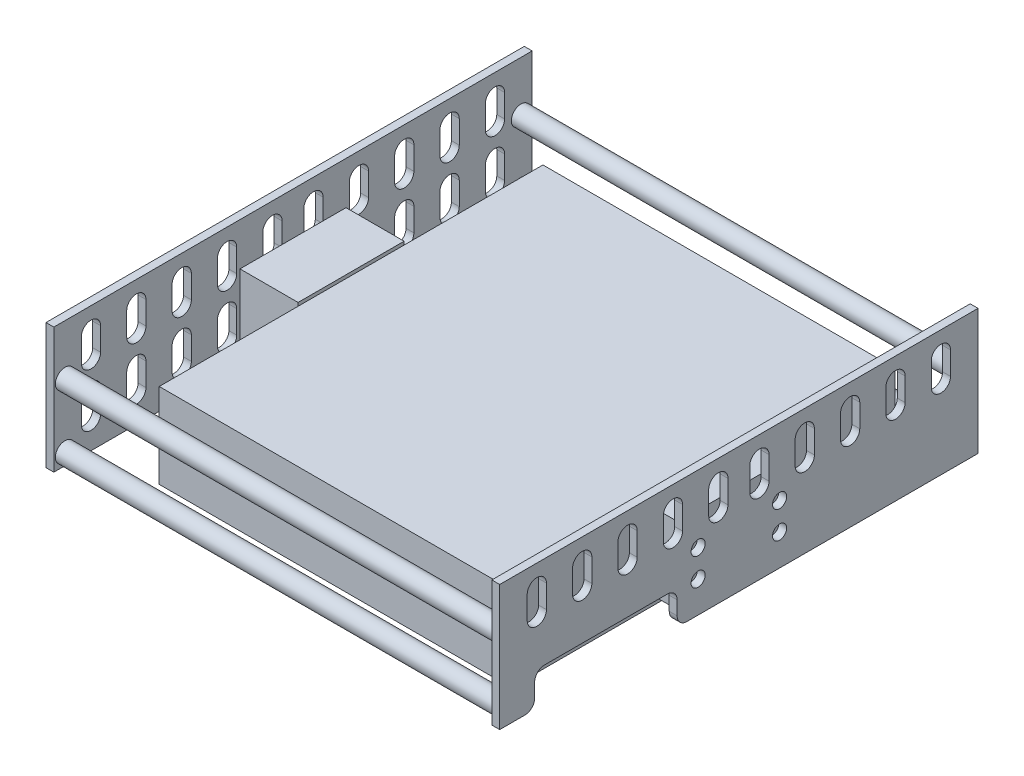
from build123d import *

# Parameters (mm, degrees)
SKETCH1_R               = 2.5019
BOSS_EXTRUDE1_DEPTH     = 115.316
BOSS_EXTRUDE1_2_DEPTH   = 115.316
BOSS_EXTRUDE1_3_DEPTH   = 115.316
BOSS_EXTRUDE1_4_DEPTH   = 115.316
SKETCH5_W               = 123.698
SKETCH5_H               = 32.512
SKETCH5_R               = 1.82245
BOSS_EXTRUDE3_DEPTH     = 2.032
SKETCH6_R               = 1.82245
BOSS_EXTRUDE4_DEPTH     = 2.032
SKETCH7_W               = 27.4193
SKETCH7_H               = 19.7612
BOSS_EXTRUDE5_DEPTH     = 7.239
SKETCH8_W               = 27.4193
SKETCH8_H               = 19.7612
BOSS_EXTRUDE6_DEPTH     = 15.0241
SKETCH9_W               = 91.0209
SKETCH9_H               = 99.2378
BOSS_EXTRUDE7_DEPTH     = 21.9329
CUT_EXTRUDE1_DEPTH      = 2.54
CUT_EXTRUDE1_DEPTH_BACK = 2.54
SKETCH10_R              = 0.508
CUT_EXTRUDE2_DEPTH      = 2.54
CUT_EXTRUDE2_DEPTH_BACK = 2.54
SKETCH11_R              = 0.508


with BuildPart() as part:
    # Sketch1 → Boss-Extrude1 (new body)
    with BuildSketch(Plane(origin=(0, 0, 0), x_dir=(0, 0, -1), z_dir=(1, 0, 0))):
        Circle(SKETCH1_R)
    extrude(amount=BOSS_EXTRUDE1_DEPTH)



with BuildPart() as body_2:
    # Sketch1 → Boss-Extrude1 2 (new body)
    with BuildSketch(Plane(origin=(0, 0, 0), x_dir=(0, 0, -1), z_dir=(1, 0, 0))):
        with Locations((0, -16.4338)):
            Circle(SKETCH1_R)
    extrude(amount=BOSS_EXTRUDE1_2_DEPTH)


with BuildPart() as body_3:
    # Sketch1 → Boss-Extrude1 3 (new body)
    with BuildSketch(Plane(origin=(0, 0, 0), x_dir=(0, 0, -1), z_dir=(1, 0, 0))):
        with Locations((117.9322, -16.4338)):
            Circle(SKETCH1_R)
    extrude(amount=BOSS_EXTRUDE1_3_DEPTH)


with BuildPart() as body_4:
    # Sketch1 → Boss-Extrude1 4 (new body)
    with BuildSketch(Plane(origin=(0, 0, 0), x_dir=(0, 0, -1), z_dir=(1, 0, 0))):
        with Locations((117.9322, 0)):
            Circle(SKETCH1_R)
    extrude(amount=BOSS_EXTRUDE1_4_DEPTH)


with BuildPart() as part_1:
    add(part.part)

    add(body_2.part)  # Boss-Extrude3 merges body 2

    add(body_3.part)  # Boss-Extrude3 merges body 3

    add(body_4.part)  # Boss-Extrude3 merges body 4
    # Sketch5 → Boss-Extrude3 (add)
    with BuildSketch(Plane(origin=(0, 0, 0), x_dir=(0, 0, -1), z_dir=(1, 0, 0))):
        with Locations((58.9661, -3.302)):
            Rectangle(SKETCH5_W, SKETCH5_H)
        with Locations((48.43145, -4.43865)):
            Circle(SKETCH5_R, mode=Mode.SUBTRACT)
        with Locations((48.43145, -11.49985)):
            Circle(SKETCH5_R, mode=Mode.SUBTRACT)
        with Locations((69.50075, -4.43865)):
            Circle(SKETCH5_R, mode=Mode.SUBTRACT)
        with Locations((69.50075, -11.49985)):
            Circle(SKETCH5_R, mode=Mode.SUBTRACT)
        with BuildLine():
            Line((66.7639, 1.27), (66.7639, 7.2136))
            ThreePointArc((66.7639, 7.2136), (64.2747, 9.7028), (61.7855, 7.2136))
            Line((61.7855, 7.2136), (61.7855, 1.27))
            ThreePointArc((61.7855, 1.27), (64.2747, -1.2192), (66.7639, 1.27))
        make_face(mode=Mode.SUBTRACT)
        with BuildLine():
            Line((66.7639, -12.5095), (66.7639, -6.5659))
            ThreePointArc((66.7639, -6.5659), (64.2747, -4.0767), (61.7855, -6.5659))
            Line((61.7855, -6.5659), (61.7855, -12.5095))
            ThreePointArc((61.7855, -12.5095), (64.2747, -14.9987), (66.7639, -12.5095))
        make_face(mode=Mode.SUBTRACT)
        with BuildLine():
            Line((78.4987, -12.5095), (78.4987, -6.5659))
            ThreePointArc((78.4987, -6.5659), (76.0095, -4.0767), (73.5203, -6.5659))
            Line((73.5203, -6.5659), (73.5203, -12.5095))
            ThreePointArc((73.5203, -12.5095), (76.0095, -14.9987), (78.4987, -12.5095))
        make_face(mode=Mode.SUBTRACT)
        with BuildLine():
            Line((4.2291, 1.27), (4.2291, 7.2136))
            ThreePointArc((4.2291, 7.2136), (6.7183, 9.7028), (9.2075, 7.2136))
            Line((9.2075, 7.2136), (9.2075, 1.27))
            ThreePointArc((9.2075, 1.27), (6.7183, -1.2192), (4.2291, 1.27))
        make_face(mode=Mode.SUBTRACT)
        with BuildLine():
            Line((15.9639, 1.27), (15.9639, 7.2136))
            ThreePointArc((15.9639, 7.2136), (18.4531, 9.7028), (20.9423, 7.2136))
            Line((20.9423, 7.2136), (20.9423, 1.27))
            ThreePointArc((20.9423, 1.27), (18.4531, -1.2192), (15.9639, 1.27))
        make_face(mode=Mode.SUBTRACT)
        with BuildLine():
            Line((27.6987, 1.27), (27.6987, 7.2136))
            ThreePointArc((27.6987, 7.2136), (30.1879, 9.7028), (32.6771, 7.2136))
            Line((32.6771, 7.2136), (32.6771, 1.27))
            ThreePointArc((32.6771, 1.27), (30.1879, -1.2192), (27.6987, 1.27))
        make_face(mode=Mode.SUBTRACT)
        with BuildLine():
            Line((39.4335, 1.27), (39.4335, 7.2136))
            ThreePointArc((39.4335, 7.2136), (41.9227, 9.7028), (44.4119, 7.2136))
            Line((44.4119, 7.2136), (44.4119, 1.27))
            ThreePointArc((44.4119, 1.27), (41.9227, -1.2192), (39.4335, 1.27))
        make_face(mode=Mode.SUBTRACT)
        with BuildLine():
            Line((51.1683, 1.27), (51.1683, 7.2136))
            ThreePointArc((51.1683, 7.2136), (53.6575, 9.7028), (56.1467, 7.2136))
            Line((56.1467, 7.2136), (56.1467, 1.27))
            ThreePointArc((56.1467, 1.27), (53.6575, -1.2192), (51.1683, 1.27))
        make_face(mode=Mode.SUBTRACT)
        with BuildLine():
            Line((15.9639, -12.5095), (15.9639, -6.5659))
            ThreePointArc((15.9639, -6.5659), (18.4531, -4.0767), (20.9423, -6.5659))
            Line((20.9423, -6.5659), (20.9423, -12.5095))
            ThreePointArc((20.9423, -12.5095), (18.4531, -14.9987), (15.9639, -12.5095))
        make_face(mode=Mode.SUBTRACT)
        with BuildLine():
            Line((27.6987, -12.5095), (27.6987, -6.5659))
            ThreePointArc((27.6987, -6.5659), (30.1879, -4.0767), (32.6771, -6.5659))
            Line((32.6771, -6.5659), (32.6771, -12.5095))
            ThreePointArc((32.6771, -12.5095), (30.1879, -14.9987), (27.6987, -12.5095))
        make_face(mode=Mode.SUBTRACT)
        with BuildLine():
            Line((39.4335, -12.5095), (39.4335, -6.5659))
            ThreePointArc((39.4335, -6.5659), (41.9227, -4.0767), (44.4119, -6.5659))
            Line((44.4119, -6.5659), (44.4119, -12.5095))
            ThreePointArc((44.4119, -12.5095), (41.9227, -14.9987), (39.4335, -12.5095))
        make_face(mode=Mode.SUBTRACT)
        with BuildLine():
            Line((51.1683, -12.5095), (51.1683, -6.5659))
            ThreePointArc((51.1683, -6.5659), (53.6575, -4.0767), (56.1467, -6.5659))
            Line((56.1467, -6.5659), (56.1467, -12.5095))
            ThreePointArc((56.1467, -12.5095), (53.6575, -14.9987), (51.1683, -12.5095))
        make_face(mode=Mode.SUBTRACT)
        with BuildLine():
            Line((4.2291, -12.5095), (4.2291, -6.5659))
            ThreePointArc((4.2291, -6.5659), (6.7183, -4.0767), (9.2075, -6.5659))
            Line((9.2075, -6.5659), (9.2075, -12.5095))
            ThreePointArc((9.2075, -12.5095), (6.7183, -14.9987), (4.2291, -12.5095))
        make_face(mode=Mode.SUBTRACT)
        with BuildLine():
            Line((78.4987, 1.27), (78.4987, 7.2136))
            ThreePointArc((78.4987, 7.2136), (76.0095, 9.7028), (73.5203, 7.2136))
            Line((73.5203, 7.2136), (73.5203, 1.27))
            ThreePointArc((73.5203, 1.27), (76.0095, -1.2192), (78.4987, 1.27))
        make_face(mode=Mode.SUBTRACT)
        with BuildLine():
            Line((90.2335, 1.27), (90.2335, 7.2136))
            ThreePointArc((90.2335, 7.2136), (87.7443, 9.7028), (85.2551, 7.2136))
            Line((85.2551, 7.2136), (85.2551, 1.27))
            ThreePointArc((85.2551, 1.27), (87.7443, -1.2192), (90.2335, 1.27))
        make_face(mode=Mode.SUBTRACT)
        with BuildLine():
            Line((90.2335, -12.5095), (90.2335, -6.5659))
            ThreePointArc((90.2335, -6.5659), (87.7443, -4.0767), (85.2551, -6.5659))
            Line((85.2551, -6.5659), (85.2551, -12.5095))
            ThreePointArc((85.2551, -12.5095), (87.7443, -14.9987), (90.2335, -12.5095))
        make_face(mode=Mode.SUBTRACT)
        with BuildLine():
            Line((101.9683, -12.5095), (101.9683, -6.5659))
            ThreePointArc((101.9683, -6.5659), (99.4791, -4.0767), (96.9899, -6.5659))
            Line((96.9899, -6.5659), (96.9899, -12.5095))
            ThreePointArc((96.9899, -12.5095), (99.4791, -14.9987), (101.9683, -12.5095))
        make_face(mode=Mode.SUBTRACT)
        with BuildLine():
            Line((101.9683, 1.27), (101.9683, 7.2136))
            ThreePointArc((101.9683, 7.2136), (99.4791, 9.7028), (96.9899, 7.2136))
            Line((96.9899, 7.2136), (96.9899, 1.27))
            ThreePointArc((96.9899, 1.27), (99.4791, -1.2192), (101.9683, 1.27))
        make_face(mode=Mode.SUBTRACT)
        with BuildLine():
            Line((113.7031, 1.27), (113.7031, 7.2136))
            ThreePointArc((113.7031, 7.2136), (111.2139, 9.7028), (108.7247, 7.2136))
            Line((108.7247, 7.2136), (108.7247, 1.27))
            ThreePointArc((108.7247, 1.27), (111.2139, -1.2192), (113.7031, 1.27))
        make_face(mode=Mode.SUBTRACT)
        with BuildLine():
            Line((113.7031, -12.5095), (113.7031, -6.5659))
            ThreePointArc((113.7031, -6.5659), (111.2139, -4.0767), (108.7247, -6.5659))
            Line((108.7247, -6.5659), (108.7247, -12.5095))
            ThreePointArc((108.7247, -12.5095), (111.2139, -14.9987), (113.7031, -12.5095))
        make_face(mode=Mode.SUBTRACT)
    extrude(amount=BOSS_EXTRUDE3_DEPTH)



with BuildPart() as body_2_2:
    # Sketch6 → Boss-Extrude4 (new body)
    with BuildSketch(Plane(origin=(115.316, 0, 0), x_dir=(0, 0, -1), z_dir=(1, 0, 0))):
        with BuildLine():
            Line((-2.8829, -19.558), (3.6195, -19.558))
            ThreePointArc((3.6195, -19.558), (5.415551224, -18.814051224), (6.1595, -17.018))
            Line((6.1595, -17.018), (6.1595, -13.4112))
            ThreePointArc((6.1595, -13.4112), (6.903448776, -11.615148776), (8.6995, -10.8712))
            Line((8.6995, -10.8712), (40.4495, -10.8712))
            ThreePointArc((40.4495, -10.8712), (42.245551224, -11.615148776), (42.9895, -13.4112))
            Line((42.9895, -13.4112), (42.9895, -17.018))
            ThreePointArc((42.9895, -17.018), (43.733448776, -18.814051224), (45.5295, -19.558))
            Line((45.5295, -19.558), (120.8151, -19.558))
            Line((120.8151, -19.558), (120.8151, 12.954))
            Line((120.8151, 12.954), (-2.8829, 12.954))
            Line((-2.8829, 12.954), (-2.8829, -19.558))
        make_face()
        with Locations((48.43145, -4.43865)):
            Circle(SKETCH6_R, mode=Mode.SUBTRACT)
        with Locations((69.50075, -4.43865)):
            Circle(SKETCH6_R, mode=Mode.SUBTRACT)
        with Locations((69.50075, -11.49985)):
            Circle(SKETCH6_R, mode=Mode.SUBTRACT)
        with Locations((48.43145, -11.49985)):
            Circle(SKETCH6_R, mode=Mode.SUBTRACT)
        with BuildLine():
            Line((15.9639, 7.2136), (15.9639, 1.27))
            ThreePointArc((15.9639, 1.27), (18.4531, -1.2192), (20.9423, 1.27))
            Line((20.9423, 1.27), (20.9423, 7.2136))
            ThreePointArc((20.9423, 7.2136), (18.4531, 9.7028), (15.9639, 7.2136))
        make_face(mode=Mode.SUBTRACT)
        with BuildLine():
            Line((9.2075, 1.27), (9.2075, 7.2136))
            ThreePointArc((9.2075, 7.2136), (6.7183, 9.7028), (4.2291, 7.2136))
            Line((4.2291, 7.2136), (4.2291, 1.27))
            ThreePointArc((4.2291, 1.27), (6.7183, -1.2192), (9.2075, 1.27))
        make_face(mode=Mode.SUBTRACT)
        with BuildLine():
            Line((27.6987, 7.2136), (27.6987, 1.27))
            ThreePointArc((27.6987, 1.27), (30.1879, -1.2192), (32.6771, 1.27))
            Line((32.6771, 1.27), (32.6771, 7.2136))
            ThreePointArc((32.6771, 7.2136), (30.1879, 9.7028), (27.6987, 7.2136))
        make_face(mode=Mode.SUBTRACT)
        with BuildLine():
            Line((39.4335, 7.2136), (39.4335, 1.27))
            ThreePointArc((39.4335, 1.27), (41.9227, -1.2192), (44.4119, 1.27))
            Line((44.4119, 1.27), (44.4119, 7.2136))
            ThreePointArc((44.4119, 7.2136), (41.9227, 9.7028), (39.4335, 7.2136))
        make_face(mode=Mode.SUBTRACT)
        with BuildLine():
            Line((51.1683, 7.2136), (51.1683, 1.27))
            ThreePointArc((51.1683, 1.27), (53.6575, -1.2192), (56.1467, 1.27))
            Line((56.1467, 1.27), (56.1467, 7.2136))
            ThreePointArc((56.1467, 7.2136), (53.6575, 9.7028), (51.1683, 7.2136))
        make_face(mode=Mode.SUBTRACT)
        with BuildLine():
            Line((61.7855, 1.27), (61.7855, 7.2136))
            ThreePointArc((61.7855, 7.2136), (64.2747, 9.7028), (66.7639, 7.2136))
            Line((66.7639, 7.2136), (66.7639, 1.27))
            ThreePointArc((66.7639, 1.27), (64.2747, -1.2192), (61.7855, 1.27))
        make_face(mode=Mode.SUBTRACT)
        with BuildLine():
            Line((73.5203, 1.27), (73.5203, 7.2136))
            ThreePointArc((73.5203, 7.2136), (76.0095, 9.7028), (78.4987, 7.2136))
            Line((78.4987, 7.2136), (78.4987, 1.27))
            ThreePointArc((78.4987, 1.27), (76.0095, -1.2192), (73.5203, 1.27))
        make_face(mode=Mode.SUBTRACT)
        with BuildLine():
            Line((85.2551, 1.27), (85.2551, 7.2136))
            ThreePointArc((85.2551, 7.2136), (87.7443, 9.7028), (90.2335, 7.2136))
            Line((90.2335, 7.2136), (90.2335, 1.27))
            ThreePointArc((90.2335, 1.27), (87.7443, -1.2192), (85.2551, 1.27))
        make_face(mode=Mode.SUBTRACT)
        with BuildLine():
            Line((96.9899, 1.27), (96.9899, 7.2136))
            ThreePointArc((96.9899, 7.2136), (99.4791, 9.7028), (101.9683, 7.2136))
            Line((101.9683, 7.2136), (101.9683, 1.27))
            ThreePointArc((101.9683, 1.27), (99.4791, -1.2192), (96.9899, 1.27))
        make_face(mode=Mode.SUBTRACT)
        with BuildLine():
            Line((113.7031, 7.2136), (113.7031, 1.27))
            ThreePointArc((113.7031, 1.27), (111.2139, -1.2192), (108.7247, 1.27))
            Line((108.7247, 1.27), (108.7247, 7.2136))
            ThreePointArc((108.7247, 7.2136), (111.2139, 9.7028), (113.7031, 7.2136))
        make_face(mode=Mode.SUBTRACT)
    extrude(amount=BOSS_EXTRUDE4_DEPTH)


with BuildPart() as part_2:
    add(part_1.part)

    add(body_2_2.part)  # Boss-Extrude5 merges body 2 2
    # Sketch7 → Boss-Extrude5 (add)
    with BuildSketch(Plane.ZY.offset(-115.316)):
        with Locations((-58.9661, -7.96925)):
            Rectangle(SKETCH7_W, SKETCH7_H)
    extrude(amount=BOSS_EXTRUDE5_DEPTH)

    # Sketch8 → Boss-Extrude6 (add)
    with BuildSketch(Plane(origin=(2.032, 0, 0), x_dir=(0, 0, -1), z_dir=(1, 0, 0))):
        with Locations((58.9661, -7.96925)):
            Rectangle(SKETCH8_W, SKETCH8_H)
    extrude(amount=BOSS_EXTRUDE6_DEPTH)


with BuildPart() as body_2_3:
    # Sketch9 → Boss-Extrude7 (new body)
    with BuildSketch(Plane(origin=(0, -20.8915, 0), x_dir=(-1, 0, 0), z_dir=(0, -1, 0))):
        with Locations((-62.56655, 58.9661)):
            Rectangle(SKETCH9_W, SKETCH9_H)
    extrude(amount=-BOSS_EXTRUDE7_DEPTH)


with BuildPart() as cut_extrude1_tool:
    # Sketch10 → Cut-Extrude1 (new, two sides: drawn at the far end of the back side and taken through both)
    with BuildSketch(Plane.ZY.offset(-17.0561).offset(-CUT_EXTRUDE1_DEPTH_BACK)):
        with Locations((-58.9661, -9.92505)):
            Circle(SKETCH10_R)
    extrude(amount=CUT_EXTRUDE1_DEPTH + CUT_EXTRUDE1_DEPTH_BACK)


with BuildPart() as part_3:
    add(part_2.part)

    # Cut-Extrude1: cut by cut_extrude1_tool
    add(cut_extrude1_tool.part, mode=Mode.SUBTRACT)


with BuildPart() as body_2_3_1:
    add(body_2_3.part)

    # Cut-Extrude1: cut by cut_extrude1_tool
    add(cut_extrude1_tool.part, mode=Mode.SUBTRACT)


with BuildPart() as cut_extrude2_tool:
    # Sketch11 → Cut-Extrude2 (new, two sides: drawn at the far end of the back side and taken through both)
    with BuildSketch(Plane(origin=(108.077, 0, 0), x_dir=(0, 0, -1), z_dir=(1, 0, 0)).offset(-CUT_EXTRUDE2_DEPTH_BACK)):
        with Locations((58.9661, -9.92505)):
            Circle(SKETCH11_R)
    extrude(amount=CUT_EXTRUDE2_DEPTH + CUT_EXTRUDE2_DEPTH_BACK)


with BuildPart() as part_4:
    add(part_3.part)

    # Cut-Extrude2: cut by cut_extrude2_tool
    add(cut_extrude2_tool.part, mode=Mode.SUBTRACT)


with BuildPart() as body_2_3_2:
    add(body_2_3_1.part)

    # Cut-Extrude2: cut by cut_extrude2_tool
    add(cut_extrude2_tool.part, mode=Mode.SUBTRACT)


solid = Compound([part_4.part, body_2_3_2.part])
